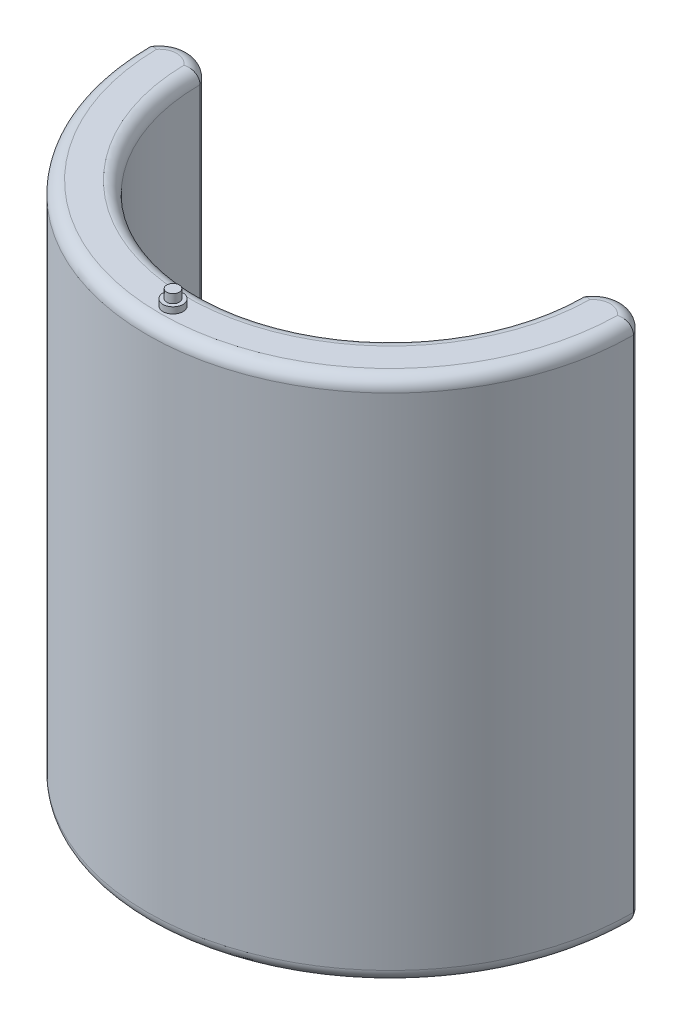
from build123d import *

# Parameters (mm, degrees)
BOSS_EXTRUDE1_DEPTH  = 95
BOSS_EXTRUDE2_DEPTH  = 10
FILLET2_R            = 5
FILLET2_OF_MIRROR1_R = 5


with BuildPart() as part:
    # Sketch1 → Boss-Extrude1 (new, symmetric)
    with BuildSketch(Plane(origin=(0, 0, 0), x_dir=(1, 0, 0), z_dir=(0, 1, 0))):
        with BuildLine():
            ThreePointArc((-76.2, 0), (0, -76.2), (76.2, 0))
            ThreePointArc((76.2, 0), (86.7, 6.190524981), (97.2, 0))
            ThreePointArc((97.2, 0), (0, -97.2), (-97.2, 0))
            ThreePointArc((-97.2, 0), (-86.7, 6.190524981), (-76.2, 0))
        make_face()
        with BuildLine():
            ThreePointArc((-79.2, 0), (0, -79.2), (79.2, 0))
            ThreePointArc((79.2, 0), (86.7, 4.025062814), (94.2, 0))
            ThreePointArc((94.2, 0), (0, -94.2), (-94.2, 0))
            ThreePointArc((-94.2, 0), (-86.7, 4.025062814), (-79.2, 0))
        make_face(mode=Mode.SUBTRACT)
    extrude(amount=BOSS_EXTRUDE1_DEPTH, both=True)

    # Sketch6 → Boss-Extrude2 (add)
    with BuildSketch(Plane.XZ.offset(95)):
        with BuildLine():
            ThreePointArc((76.2, 0), (86.7, -6.190524981), (97.2, 0))
            ThreePointArc((97.2, 0), (0, 97.2), (-97.2, 0))
            ThreePointArc((-97.2, 0), (-86.7, -6.190524981), (-76.2, 0))
            ThreePointArc((-76.2, 0), (0, 76.2), (76.2, 0))
        make_face()
    boss_extrude2 = extrude(amount=BOSS_EXTRUDE2_DEPTH)

    # Fillet2
    # the kernel refuses this fillet: 5 mm, written as the material it takes off along each edge
    with BuildSketch(Plane(origin=(0, -105, 0), x_dir=(-0.9978410654682823, 0, -0.06567501857725805), z_dir=(0.06567501857725805, 0, -0.9978410654682823))) as fillet2_piece_1:
        with BuildLine():
            CenterArc((76.2 + FILLET2_R, FILLET2_R), FILLET2_R, 180, 90)
            Line((76.2 + FILLET2_R, 0), (76.2 + FILLET2_R, -FILLET2_R * 0.02))
            Line((76.2 + FILLET2_R, -FILLET2_R * 0.02), (76.2 - FILLET2_R * 0.02, -FILLET2_R * 0.02))
            Line((76.2 - FILLET2_R * 0.02, -FILLET2_R * 0.02), (76.2 - FILLET2_R * 0.02, FILLET2_R))
            Line((76.2 - FILLET2_R * 0.02, FILLET2_R), (76.2, FILLET2_R))
        make_face()
    revolve(axis=Axis((0, -105, 0), (0, 1, 0)), revolution_arc=187.531223354, mode=Mode.SUBTRACT)
    with BuildSketch(Plane(origin=(86.7, -105, 5.809475019), x_dir=(-0.9960965214021965, 0, -0.08827072023294943), z_dir=(-0.08827072023294943, 0, 0.9960965214021965))) as fillet2_piece_2:
        with BuildLine():
            CenterArc((12 - FILLET2_R, -FILLET2_R), FILLET2_R, 0, 90)
            Line((12 - FILLET2_R, 0), (12 - FILLET2_R, FILLET2_R * 0.02))
            Line((12 - FILLET2_R, FILLET2_R * 0.02), (12 + FILLET2_R * 0.02, FILLET2_R * 0.02))
            Line((12 + FILLET2_R * 0.02, FILLET2_R * 0.02), (12 + FILLET2_R * 0.02, -FILLET2_R))
            Line((12 + FILLET2_R * 0.02, -FILLET2_R), (12, -FILLET2_R))
        make_face()
    revolve(axis=Axis((86.7, -105, 5.809475019), (0, -1, 0)), revolution_arc=169.871738636, mode=Mode.SUBTRACT)
    with BuildSketch(Plane(origin=(0, -105, 0), x_dir=(0.9986729810025154, 0, -0.05150026228622047), z_dir=(-0.05150026228622047, 0, -0.9986729810025154))) as fillet2_piece_3:
        with BuildLine():
            CenterArc((97.2 - FILLET2_R, -FILLET2_R), FILLET2_R, 0, 90)
            Line((97.2, -FILLET2_R), (97.2 + FILLET2_R * 0.02, -FILLET2_R))
            Line((97.2 + FILLET2_R * 0.02, -FILLET2_R), (97.2 + FILLET2_R * 0.02, FILLET2_R * 0.02))
            Line((97.2 + FILLET2_R * 0.02, FILLET2_R * 0.02), (97.2 - FILLET2_R, FILLET2_R * 0.02))
            Line((97.2 - FILLET2_R, FILLET2_R * 0.02), (97.2 - FILLET2_R, 0))
        make_face()
    revolve(axis=Axis((0, -105, 0), (0, -1, 0)), revolution_arc=185.904107198, mode=Mode.SUBTRACT)
    with BuildSketch(Plane(origin=(-86.7, -105, 5.809475019), x_dir=(-0.9960965214021962, 0, -0.08827072023295163), z_dir=(-0.08827072023295163, 0, 0.9960965214021962))) as fillet2_piece_4:
        with BuildLine():
            CenterArc((12 - FILLET2_R, -FILLET2_R), FILLET2_R, 0, 90)
            Line((12 - FILLET2_R, 0), (12 - FILLET2_R, FILLET2_R * 0.02))
            Line((12 - FILLET2_R, FILLET2_R * 0.02), (12 + FILLET2_R * 0.02, FILLET2_R * 0.02))
            Line((12 + FILLET2_R * 0.02, FILLET2_R * 0.02), (12 + FILLET2_R * 0.02, -FILLET2_R))
            Line((12 + FILLET2_R * 0.02, -FILLET2_R), (12, -FILLET2_R))
        make_face()
    revolve(axis=Axis((-86.7, -105, 5.809475019), (0, -1, 0)), revolution_arc=169.871738636, mode=Mode.SUBTRACT)

    # Mirror1: Boss-Extrude2 across plane
    add(boss_extrude2.mirror(Plane.ZX))

    # Fillet2 of Mirror1
    # the kernel refuses this fillet: 5 mm, written as the material it takes off along each edge
    with BuildSketch(Plane(origin=(0, 105, 0), x_dir=(-0.9978410654682823, 0, -0.06567501857725805), z_dir=(0.06567501857725805, 0, -0.9978410654682823))) as fillet2_of_mirror1_piece_1:
        with BuildLine():
            CenterArc((76.2 + FILLET2_OF_MIRROR1_R, -FILLET2_OF_MIRROR1_R), FILLET2_OF_MIRROR1_R, 90, 90)
            Line((76.2, -FILLET2_OF_MIRROR1_R), (76.2 - FILLET2_OF_MIRROR1_R * 0.02, -FILLET2_OF_MIRROR1_R))
            Line((76.2 - FILLET2_OF_MIRROR1_R * 0.02, -FILLET2_OF_MIRROR1_R), (76.2 - FILLET2_OF_MIRROR1_R * 0.02, FILLET2_OF_MIRROR1_R * 0.02))
            Line((76.2 - FILLET2_OF_MIRROR1_R * 0.02, FILLET2_OF_MIRROR1_R * 0.02), (76.2 + FILLET2_OF_MIRROR1_R, FILLET2_OF_MIRROR1_R * 0.02))
            Line((76.2 + FILLET2_OF_MIRROR1_R, FILLET2_OF_MIRROR1_R * 0.02), (76.2 + FILLET2_OF_MIRROR1_R, 0))
        make_face()
    revolve(axis=Axis((0, 105, 0), (0, 1, 0)), revolution_arc=187.531223354, mode=Mode.SUBTRACT)
    with BuildSketch(Plane(origin=(86.7, 105, 5.809475019), x_dir=(-0.9960965214021965, 0, -0.08827072023294943), z_dir=(-0.08827072023294943, 0, 0.9960965214021965))) as fillet2_of_mirror1_piece_2:
        with BuildLine():
            CenterArc((12 - FILLET2_OF_MIRROR1_R, FILLET2_OF_MIRROR1_R), FILLET2_OF_MIRROR1_R, 270, 90)
            Line((12, FILLET2_OF_MIRROR1_R), (12 + FILLET2_OF_MIRROR1_R * 0.02, FILLET2_OF_MIRROR1_R))
            Line((12 + FILLET2_OF_MIRROR1_R * 0.02, FILLET2_OF_MIRROR1_R), (12 + FILLET2_OF_MIRROR1_R * 0.02, -FILLET2_OF_MIRROR1_R * 0.02))
            Line((12 + FILLET2_OF_MIRROR1_R * 0.02, -FILLET2_OF_MIRROR1_R * 0.02), (12 - FILLET2_OF_MIRROR1_R, -FILLET2_OF_MIRROR1_R * 0.02))
            Line((12 - FILLET2_OF_MIRROR1_R, -FILLET2_OF_MIRROR1_R * 0.02), (12 - FILLET2_OF_MIRROR1_R, 0))
        make_face()
    revolve(axis=Axis((86.7, 105, 5.809475019), (0, -1, 0)), revolution_arc=169.871738636, mode=Mode.SUBTRACT)
    with BuildSketch(Plane(origin=(0, 105, 0), x_dir=(0.9986729810025154, 0, -0.05150026228622047), z_dir=(-0.05150026228622047, 0, -0.9986729810025154))) as fillet2_of_mirror1_piece_3:
        with BuildLine():
            CenterArc((97.2 - FILLET2_OF_MIRROR1_R, FILLET2_OF_MIRROR1_R), FILLET2_OF_MIRROR1_R, 270, 90)
            Line((97.2, FILLET2_OF_MIRROR1_R), (97.2 + FILLET2_OF_MIRROR1_R * 0.02, FILLET2_OF_MIRROR1_R))
            Line((97.2 + FILLET2_OF_MIRROR1_R * 0.02, FILLET2_OF_MIRROR1_R), (97.2 + FILLET2_OF_MIRROR1_R * 0.02, -FILLET2_OF_MIRROR1_R * 0.02))
            Line((97.2 + FILLET2_OF_MIRROR1_R * 0.02, -FILLET2_OF_MIRROR1_R * 0.02), (97.2 - FILLET2_OF_MIRROR1_R, -FILLET2_OF_MIRROR1_R * 0.02))
            Line((97.2 - FILLET2_OF_MIRROR1_R, -FILLET2_OF_MIRROR1_R * 0.02), (97.2 - FILLET2_OF_MIRROR1_R, 0))
        make_face()
    revolve(axis=Axis((0, 105, 0), (0, -1, 0)), revolution_arc=185.904107198, mode=Mode.SUBTRACT)
    with BuildSketch(Plane(origin=(-86.7, 105, 5.809475019), x_dir=(-0.9960965214021962, 0, -0.08827072023295163), z_dir=(-0.08827072023295163, 0, 0.9960965214021962))) as fillet2_of_mirror1_piece_4:
        with BuildLine():
            CenterArc((12 - FILLET2_OF_MIRROR1_R, FILLET2_OF_MIRROR1_R), FILLET2_OF_MIRROR1_R, 270, 90)
            Line((12 - FILLET2_OF_MIRROR1_R, 0), (12 - FILLET2_OF_MIRROR1_R, -FILLET2_OF_MIRROR1_R * 0.02))
            Line((12 - FILLET2_OF_MIRROR1_R, -FILLET2_OF_MIRROR1_R * 0.02), (12 + FILLET2_OF_MIRROR1_R * 0.02, -FILLET2_OF_MIRROR1_R * 0.02))
            Line((12 + FILLET2_OF_MIRROR1_R * 0.02, -FILLET2_OF_MIRROR1_R * 0.02), (12 + FILLET2_OF_MIRROR1_R * 0.02, FILLET2_OF_MIRROR1_R))
            Line((12 + FILLET2_OF_MIRROR1_R * 0.02, FILLET2_OF_MIRROR1_R), (12, FILLET2_OF_MIRROR1_R))
        make_face()
    revolve(axis=Axis((-86.7, 105, 5.809475019), (0, -1, 0)), revolution_arc=169.871738636, mode=Mode.SUBTRACT)

    # Sketch9 → Revolve1 (revolve)
    with BuildSketch(Plane.XY.offset(87)):
        Polygon((-4, 105), (-4, 107.5), (-2.5, 107.5), (-2.5, 111), (0, 111), (0, 105), align=None)
    revolve(axis=Axis((0, 111, 87), (0, -1, 0)))


solid = part.part
